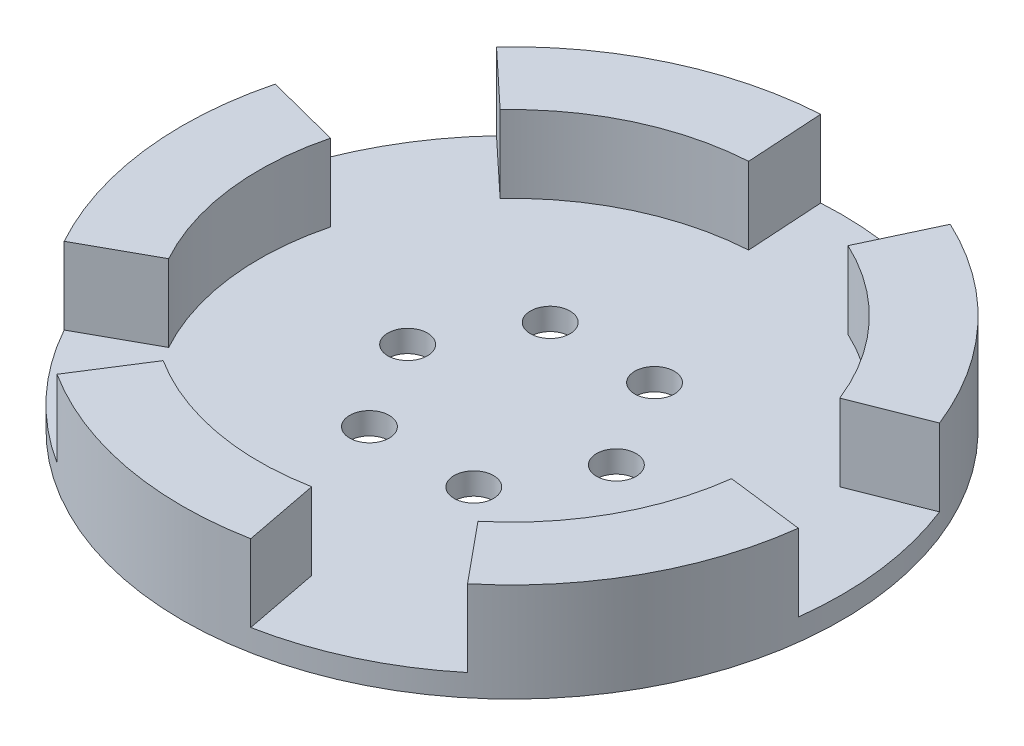
from build123d import *

# Parameters (mm, degrees)
SKETCH3_R           = 30
BOSS_EXTRUDE3_DEPTH = 2
BOSS_EXTRUDE4_DEPTH = 7
SKETCH5_R           = 1.8
CUT_EXTRUDE1_DEPTH  = 10


with BuildPart() as part:
    # Sketch3 → Boss-Extrude3 (new body)
    with BuildSketch(Plane(origin=(0, 0, 0), x_dir=(1, 0, 0), z_dir=(0, 1, 0))):
        Circle(SKETCH3_R)
    extrude(amount=BOSS_EXTRUDE3_DEPTH)

    # Sketch4 → Boss-Extrude4 (add)
    with BuildSketch(Plane(origin=(0, 2, 0), x_dir=(1, 0, 0), z_dir=(0, 1, 0))):
        with BuildLine():
            Line((14.638601317, -17.740105735), (19.093827805, -23.13926835))
            ThreePointArc((19.093827805, -23.13926835), (26.293545079, -14.444704468), (29.770348498, -3.704908943))
            Line((29.770348498, -3.704908943), (22.823933849, -2.84043019))
            ThreePointArc((22.823933849, -2.84043019), (20.158384561, -11.074273425), (14.638601317, -17.740105735))
        make_face()
        with BuildLine():
            Line((21.39541974, 8.440143018), (27.907069226, 11.008882197))
            ThreePointArc((27.907069226, 11.008882197), (21.862882582, 20.542988225), (12.723121407, 27.168404106))
            Line((12.723121407, 27.168404106), (9.754393079, 20.829109814))
            ThreePointArc((9.754393079, 20.829109814), (16.761543313, 15.749624306), (21.39541974, 8.440143018))
        make_face()
        with BuildLine():
            Line((-1.415504714, 22.95640099), (-1.846310497, 29.943131726))
            ThreePointArc((-1.846310497, 29.943131726), (-12.781540551, 27.140969421), (-21.907027026, 20.495906101))
            Line((-21.907027026, 20.495906101), (-16.795387386, 15.713528011))
            ThreePointArc((-16.795387386, 15.713528011), (-9.799181089, 20.808076556), (-1.415504714, 22.95640099))
        make_face()
        with BuildLine():
            Line((-22.270249764, 5.747693053), (-29.048151867, 7.496990939))
            ThreePointArc((-29.048151867, 7.496990939), (-29.762309071, -3.768946635), (-26.262408702, -14.501237505))
            Line((-26.262408702, -14.501237505), (-20.134513338, -11.117615421))
            ThreePointArc((-20.134513338, -11.117615421), (-22.817770288, -2.889525753), (-22.270249764, 5.747693053))
        make_face()
        with BuildLine():
            Line((-12.348266578, -19.404131326), (-16.106434667, -25.309736512))
            ThreePointArc((-16.106434667, -25.309736512), (-5.612578038, -29.470306543), (5.675965822, -29.458163758))
            Line((5.675965822, -29.458163758), (4.351573797, -22.584592214))
            ThreePointArc((4.351573797, -22.584592214), (-4.302976496, -22.593901683), (-12.348266578, -19.404131326))
        make_face()
    extrude(amount=BOSS_EXTRUDE4_DEPTH)

    # Sketch5 → Cut-Extrude1 (cut)
    with BuildSketch(Plane.XZ):
        with Locations((-4.75, 8.227241336)):
            Circle(SKETCH5_R)
        with Locations((4.75, 8.227241336)):
            Circle(SKETCH5_R)
        with Locations((9.5, 0)):
            Circle(SKETCH5_R)
        with Locations((4.75, -8.227241336)):
            Circle(SKETCH5_R)
        with Locations((-4.75, -8.227241336)):
            Circle(SKETCH5_R)
        with Locations((-9.5, 0)):
            Circle(SKETCH5_R)
    extrude(amount=-CUT_EXTRUDE1_DEPTH, mode=Mode.SUBTRACT)


solid = part.part
